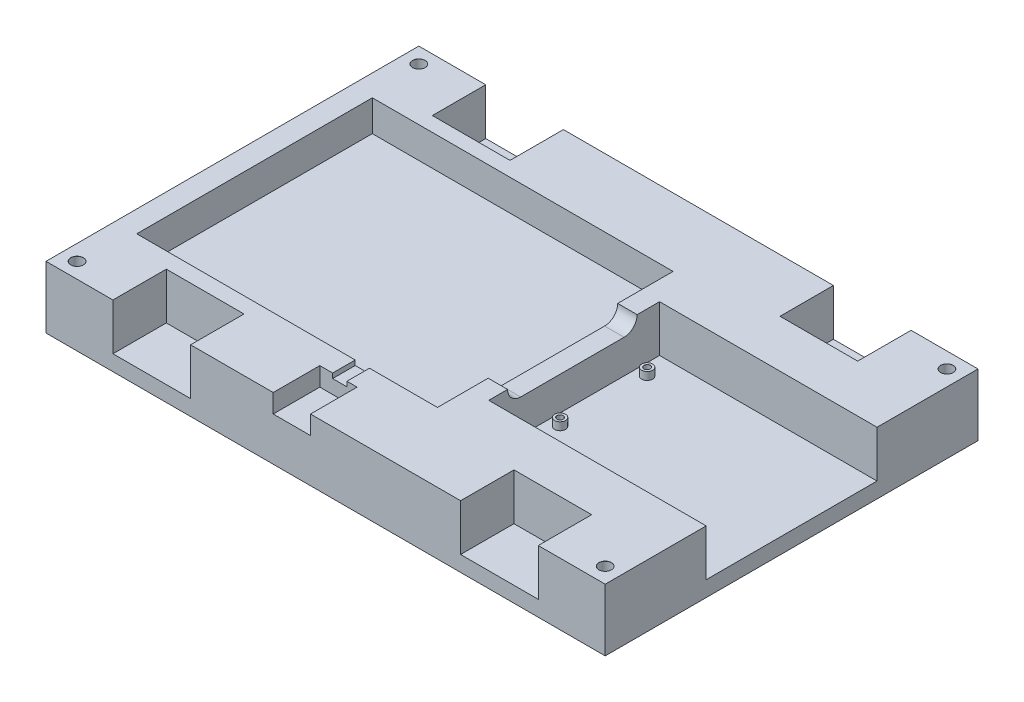
from build123d import *

# Parameters (mm, degrees)
SKETCH1_W                          = 180
SKETCH1_H                          = 120
BOSS_EXTRUDE1_DEPTH                = 20
CUT_EXTRUDE1_DEPTH                 = 15
SKETCH3_W                          = 25
SKETCH3_H                          = 34.37
CUT_EXTRUDE2_DEPTH                 = 15
MIRROR2_COPY_1_SKETCH_W            = 25
MIRROR2_COPY_1_SKETCH_H            = 34.37
MIRROR2_COPY_1_DEPTH               = 15
SKETCH4_W                          = 96.808518295
SKETCH4_H                          = 75.84152956
CUT_EXTRUDE4_DEPTH                 = 10
SKETCH6_R                          = 1.750328968
SKETCH6_R_2                        = 1.75
BOSS_EXTRUDE2_DEPTH                = 2.5
F_2_0_2_DIAMETER_HOLE1_D           = 2
F_2_0_2_DIAMETER_HOLE1_DEPTH       = 2
F_2_0_2_DIAMETER_HOLE1_CSINK_D     = 2.05
F_2_0_2_DIAMETER_HOLE1_CSINK_ANGLE = 92
F_2_0_2_DIAMETER_HOLE1_TIP         = 0.600860619
F_4_0_4_DIAMETER_HOLE3_D           = 4
F_4_0_4_DIAMETER_HOLE3_DEPTH       = 5
F_4_0_4_DIAMETER_HOLE3_CSINK_D     = 4.05
F_4_0_4_DIAMETER_HOLE3_CSINK_ANGLE = 92
F_4_0_4_DIAMETER_HOLE3_TIP         = 1.201721238
CUT_EXTRUDE5_DEPTH                 = 10
SKETCH21_W                         = 12
SKETCH21_H                         = 6
CUT_EXTRUDE6_DEPTH                 = 15
SKETCH22_W                         = 4.598500527
SKETCH22_H                         = 1.553809511
CUT_EXTRUDE7_DEPTH                 = 15


with BuildPart() as part:
    # Sketch1 → Boss-Extrude1 (new body)
    with BuildSketch(Plane(origin=(0, 0, 0), x_dir=(1, 0, 0), z_dir=(0, 1, 0))):
        Rectangle(SKETCH1_W, SKETCH1_H)
    extrude(amount=BOSS_EXTRUDE1_DEPTH)

    # Sketch2 → Cut-Extrude1 (cut)
    with BuildSketch(Plane(origin=(0, 20, 0), x_dir=(1, 0, 0), z_dir=(0, 1, 0))):
        Polygon((90, 0), (90, 27.5), (20, 27.5), (20, -27.5), (90, -27.5), align=None)
    extrude(amount=-CUT_EXTRUDE1_DEPTH, mode=Mode.SUBTRACT)

    # Sketch3 → Cut-Extrude2 (cut)
    with BuildSketch(Plane(origin=(0, 20, 0), x_dir=(1, 0, 0), z_dir=(0, 1, 0))):
        with Locations((55.95586419, -60)):
            Rectangle(SKETCH3_W, SKETCH3_H)
    cut_extrude2 = extrude(amount=-CUT_EXTRUDE2_DEPTH, mode=Mode.SUBTRACT)

    # Mirror1: Cut-Extrude2 across plane
    add(cut_extrude2.mirror(Plane(origin=(0, 0, 0), x_dir=(0, 0, 1), z_dir=(1, 0, 0))), mode=Mode.SUBTRACT)

    # Mirror2: Cut-Extrude2 across plane
    add(cut_extrude2.mirror(Plane.XY), mode=Mode.SUBTRACT)

    # Mirror2 copy 1 sketch → Mirror2 copy 1 (cut)
    with BuildSketch(Plane(origin=(0, 20, 0), x_dir=(-1, 0, 0), z_dir=(0, 1, 0))):
        with Locations((55.95586419, -60)):
            Rectangle(MIRROR2_COPY_1_SKETCH_W, MIRROR2_COPY_1_SKETCH_H)
    extrude(amount=-MIRROR2_COPY_1_DEPTH, mode=Mode.SUBTRACT)

    # Sketch4 → Cut-Extrude4 (cut)
    with BuildSketch(Plane(origin=(0, 20, 0), x_dir=(1, 0, 0), z_dir=(0, 1, 0))):
        with Locations((-34.664426112, 0.188234574)):
            Rectangle(SKETCH4_W, SKETCH4_H)
    extrude(amount=-CUT_EXTRUDE4_DEPTH, mode=Mode.SUBTRACT)

    # Sketch6 → Boss-Extrude2 (add)
    with BuildSketch(Plane(origin=(0, 5, 0), x_dir=(1, 0, 0), z_dir=(0, 1, 0))):
        with Locations((23.740233284, 19.759861377)):
            Circle(SKETCH6_R)
        with Locations((23.740233284, -8.257995296)):
            Circle(SKETCH6_R_2)
        with Locations((74.958841447, -23.692393533)):
            Circle(SKETCH6_R_2)
    extrude(amount=BOSS_EXTRUDE2_DEPTH)

    # Ø2.0 (2) Diameter Hole1
    with Locations(Plane(origin=(23.740233284, 7.5, -19.759861377), x_dir=(0, 0, 1), z_dir=(0, 1, 0))):
        with Locations((0, 0), (28.017856673, 0), (43.45225491, 51.218608163)):
            CounterSinkHole(F_2_0_2_DIAMETER_HOLE1_D / 2, F_2_0_2_DIAMETER_HOLE1_CSINK_D / 2, depth=F_2_0_2_DIAMETER_HOLE1_DEPTH, counter_sink_angle=F_2_0_2_DIAMETER_HOLE1_CSINK_ANGLE)
            with Locations((0, 0, -(F_2_0_2_DIAMETER_HOLE1_DEPTH + F_2_0_2_DIAMETER_HOLE1_TIP / 2))):  # 118° drill point
                Cone(0, F_2_0_2_DIAMETER_HOLE1_D / 2, F_2_0_2_DIAMETER_HOLE1_TIP, mode=Mode.SUBTRACT)

    # Ø4.0 (4) Diameter Hole3
    with Locations(Plane(origin=(-85, 20, -55), x_dir=(0, 0, 1), z_dir=(0, 1, 0))):
        with Locations((0, 0), (0, 170), (110, 170), (110, 0)):
            CounterSinkHole(F_4_0_4_DIAMETER_HOLE3_D / 2, F_4_0_4_DIAMETER_HOLE3_CSINK_D / 2, depth=F_4_0_4_DIAMETER_HOLE3_DEPTH, counter_sink_angle=F_4_0_4_DIAMETER_HOLE3_CSINK_ANGLE)
            with Locations((0, 0, -(F_4_0_4_DIAMETER_HOLE3_DEPTH + F_4_0_4_DIAMETER_HOLE3_TIP / 2))):  # 118° drill point
                Cone(0, F_4_0_4_DIAMETER_HOLE3_D / 2, F_4_0_4_DIAMETER_HOLE3_TIP, mode=Mode.SUBTRACT)

    # Sketch19 → Cut-Extrude5 (cut)
    with BuildSketch(Plane(origin=(20, 0, 0), x_dir=(0, 0, -1), z_dir=(1, 0, 0))):
        with BuildLine():
            Line((-17.205162996, 24.206637085), (16.076682843, 24.206637085))
            ThreePointArc((16.076682843, 24.206637085), (20.283319928, 20), (16.076682843, 15.793362915))
            Line((16.076682843, 15.793362915), (-17.205162996, 15.793362915))
            ThreePointArc((-17.205162996, 15.793362915), (-21.411800081, 20), (-17.205162996, 24.206637085))
        make_face()
    extrude(amount=-CUT_EXTRUDE5_DEPTH, mode=Mode.SUBTRACT)

    # Sketch21 → Cut-Extrude6 (cut)
    with BuildSketch(Plane.XY.offset(60)):
        with Locations((-10.862980205, 17)):
            Rectangle(SKETCH21_W, SKETCH21_H)
    extrude(amount=-CUT_EXTRUDE6_DEPTH, mode=Mode.SUBTRACT)

    # Sketch22 → Cut-Extrude7 (cut)
    with BuildSketch(Plane(origin=(0, 0, 37.732530206), x_dir=(-1, 0, 0), z_dir=(0, 0, -1))):
        with Locations((10.435709391, 19.223095245)):
            Rectangle(SKETCH22_W, SKETCH22_H)
    extrude(amount=-CUT_EXTRUDE7_DEPTH, mode=Mode.SUBTRACT)


solid = part.part
